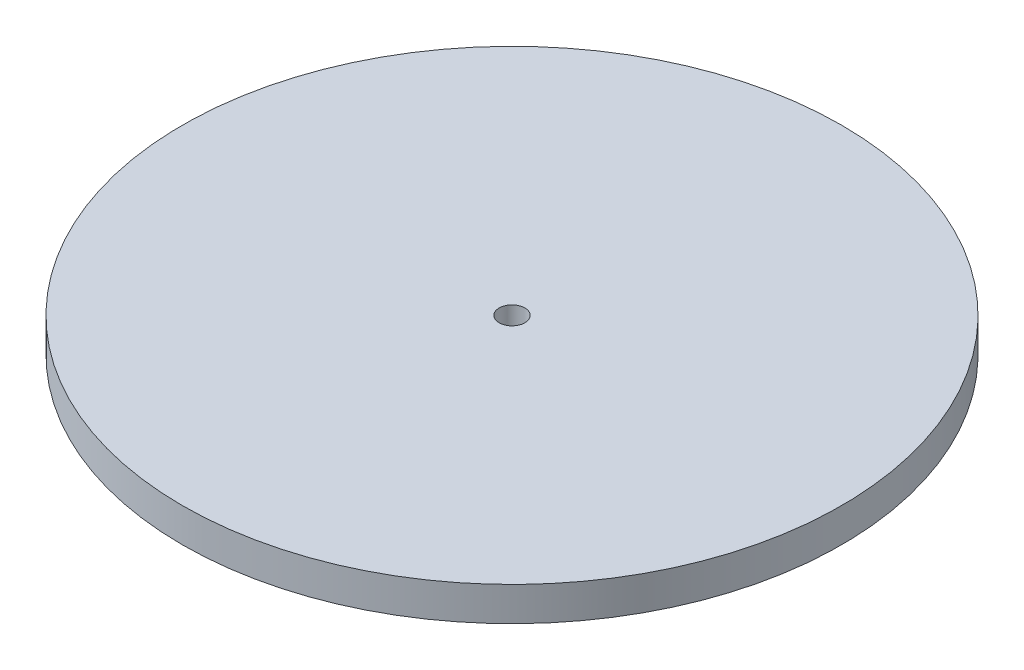
from build123d import *

# Parameters (mm, degrees)
SKETCH1_R       = 64
SKETCH1_R_2     = 2.5
PROP_DISC_DEPTH = 6.6


with BuildPart() as part:
    # Sketch1 → Prop disc (new body)
    with BuildSketch(Plane(origin=(0, 0, 0), x_dir=(1, 0, 0), z_dir=(0, 1, 0))):
        Circle(SKETCH1_R)
        Circle(SKETCH1_R_2, mode=Mode.SUBTRACT)
    extrude(amount=PROP_DISC_DEPTH)


solid = part.part
